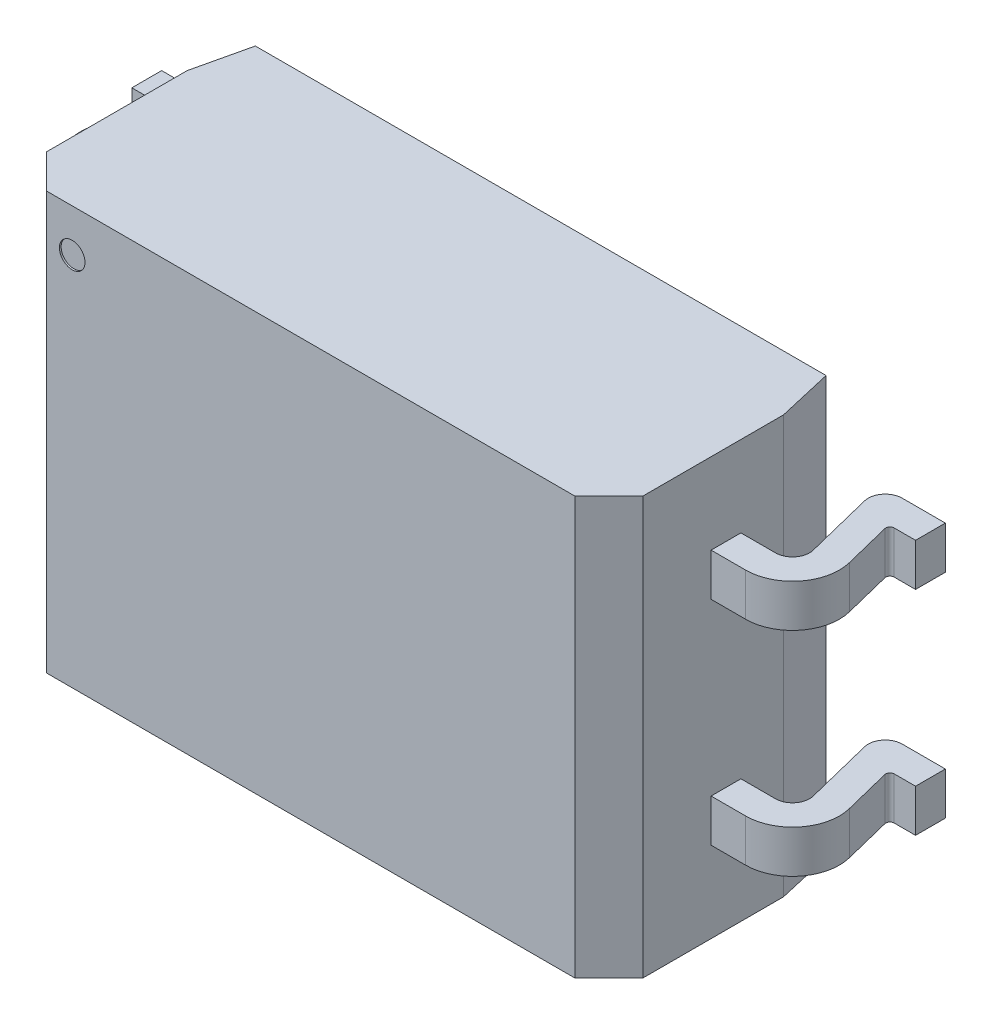
from build123d import *

# Parameters (mm, degrees)
SKETCH_2_W                     = 4.9
SKETCH_2_H                     = 7
EXTRUDE_1_DEPTH                = 2.7
EXTRUDE_2_DEPTH                = 0.25
FILLET_1_R                     = 0.05
CHAMFER_1_SIZE                 = 0.4
PATTERN_LINEAR_2_COUNT         = 2
PATTERN_LINEAR_2_PITCH         = 2.5
FILLET_1_OF_PATTERN_LINEAR_2_R = 0.05
MIRROR_START                   = -1.5
MIRROR_1_DEPTH                 = 0.5
MIRROR_START_2                 = 1
MIRROR_1_2_DEPTH               = 0.5
CHAMFER_2_SIZE                 = 0.4
CHAMFER_3_SIZE                 = 0.15
CHAMFER_3_SIZE2                = 0.649721381
CHAMFER_4_SIZE                 = 0.15
CHAMFER_4_SIZE2                = 0.649721381
SKETCH_7_R                     = 0.15
CUT_EXTRUDE_2_DEPTH            = 0.02
MOVE_BODY_2_ANGLE              = 120


with BuildPart() as part:
    # Эскиз2 → Бобышка-Вытянуть1 (new body)
    with BuildSketch(Plane(origin=(0, 0.15, 0), x_dir=(-1, 0, 0), z_dir=(0, 1, 0))):
        Rectangle(SKETCH_2_W, SKETCH_2_H)
    extrude(amount=EXTRUDE_1_DEPTH)

    # Эскиз4 → Вытянуть-Тонкостенный2 (add, symmetric)
    with BuildSketch(Plane(origin=(1.25, 0, 0), x_dir=(0, 0, -1), z_dir=(1, 0, 0))):
        with BuildLine():
            Line((-3.5, 1.3), (-3.905923723, 1.3))
            ThreePointArc((-3.905923723, 1.3), (-4.063504056, 1.223160215), (-4.1, 1.051684386))
            Line((-4.1, 1.051684386), (-3.9, 0.248315614))
            ThreePointArc((-3.9, 0.248315614), (-3.936495944, 0.076839785), (-4.094076277, 0))
            Line((-4.094076277, 0), (-4.6, 0))
            Line((-4.6, 0), (-4.6, 0.35))
            Line((-4.6, 0.35), (-4.285997426, 0.35))
            Line((-4.285997426, 0.35), (-4.439633485, 0.967132062))
            ThreePointArc((-4.439633485, 0.967132062), (-4.339269639, 1.438690592), (-3.905923723, 1.65))
            Line((-3.905923723, 1.65), (-3.5, 1.65))
            Line((-3.5, 1.65), (-3.5, 1.3))
        make_face()
    extrude_2 = extrude(amount=EXTRUDE_2_DEPTH, both=True)

    # Скругление1
    fillet_1_edges = [part.edges().sort_by_distance(p)[0] for p in [
        (1.25, 0.35, 4.285997426),
    ]]
    fillet(fillet_1_edges, radius=FILLET_1_R)

    # Фаска1
    chamfer_1_edges = [part.edges().sort_by_distance(p)[0] for p in [
        (0, 2.85, 3.5),
    ]]
    chamfer(chamfer_1_edges, length=CHAMFER_1_SIZE)

    # Линейный массив2: Вытянуть-Тонкостенный2 ×2
    with Locations(*[(-i * PATTERN_LINEAR_2_PITCH, 0, 0) for i in range(1, PATTERN_LINEAR_2_COUNT)]):
        add(extrude_2)

    # Скругление1 of Линейный массив2
    fillet_1_of_pattern_linear_2_edges = [part.edges().sort_by_distance(p)[0] for p in [
        (-1.25, 0.35, 4.285997426),
    ]]
    fillet(fillet_1_of_pattern_linear_2_edges, radius=FILLET_1_OF_PATTERN_LINEAR_2_R)

    # Зеркальное отражение1: read off the stored shape, not the designer's step
    # Зеркальное отражение1 outline → Зеркальное отражение1 (add)
    with BuildSketch(Plane.YZ.offset(MIRROR_START)):
        with BuildLine():
            Line((0, -4.6), (0.35, -4.6))
            Line((0.35, -4.6), (0.35, -4.349971142))
            ThreePointArc((0.35, -4.349971142), (0.369209946, -4.310576059), (0.412078903, -4.301452073))
            Line((0.412078903, -4.301452073), (0.967132062, -4.439633485))
            ThreePointArc((0.967132062, -4.439633485), (1.438690592, -4.339269639), (1.65, -3.905923723))
            Line((1.65, -3.905923723), (1.65, -3.5))
            Line((1.65, -3.5), (1.3, -3.5))
            Line((1.3, -3.5), (1.3, -3.905923723))
            ThreePointArc((1.3, -3.905923723), (1.223160215, -4.063504056), (1.051684386, -4.1))
            Line((1.051684386, -4.1), (0.248315614, -3.9))
            ThreePointArc((0.248315614, -3.9), (0.076839785, -3.936495944), (0, -4.094076277))
            Line((0, -4.094076277), (0, -4.6))
        make_face()
    extrude(amount=MIRROR_1_DEPTH)

    # Mirror 1 2 outline → Mirror 1 2 (add)
    with BuildSketch(Plane.YZ.offset(MIRROR_START_2)):
        with BuildLine():
            Line((0, -4.6), (0.35, -4.6))
            Line((0.35, -4.6), (0.35, -4.349971142))
            ThreePointArc((0.35, -4.349971142), (0.369209946, -4.310576059), (0.412078903, -4.301452073))
            Line((0.412078903, -4.301452073), (0.967132062, -4.439633485))
            ThreePointArc((0.967132062, -4.439633485), (1.438690592, -4.339269639), (1.65, -3.905923723))
            Line((1.65, -3.905923723), (1.65, -3.5))
            Line((1.65, -3.5), (1.3, -3.5))
            Line((1.3, -3.5), (1.3, -3.905923723))
            ThreePointArc((1.3, -3.905923723), (1.223160215, -4.063504056), (1.051684386, -4.1))
            Line((1.051684386, -4.1), (0.248315614, -3.9))
            ThreePointArc((0.248315614, -3.9), (0.076839785, -3.936495944), (0, -4.094076277))
            Line((0, -4.094076277), (0, -4.6))
        make_face()
    extrude(amount=MIRROR_1_2_DEPTH)

    # Фаска2
    chamfer_2_edges = [part.edges().sort_by_distance(p)[0] for p in [
        (0, 2.85, -3.5),
    ]]
    chamfer(chamfer_2_edges, length=CHAMFER_2_SIZE)

    # Фаска3
    chamfer_3_edges = [part.edges().sort_by_distance(p)[0] for p in [
        (0, 0.15, -3.5),
    ]]
    chamfer_3_side = [part.faces().sort_by_distance(p)[0] for p in [
        (0, 0.15, 0),
    ]]
    chamfer(chamfer_3_edges, length=CHAMFER_3_SIZE, length2=CHAMFER_3_SIZE2, reference=chamfer_3_side[0])

    # Фаска4
    chamfer_4_edges = [part.edges().sort_by_distance(p)[0] for p in [
        (0, 0.15, 3.5),
    ]]
    chamfer_4_side = [part.faces().sort_by_distance(p)[0] for p in [
        (0, 0.15, 0.075),
    ]]
    chamfer(chamfer_4_edges, length=CHAMFER_4_SIZE, length2=CHAMFER_4_SIZE2, reference=chamfer_4_side[0])

    # Эскиз7 → Вырез-Вытянуть2 (cut)
    with BuildSketch(Plane(origin=(0, 2.85, 0), x_dir=(1, 0, 0), z_dir=(0, 1, 0))):
        with Locations(Location((-1.95, -2.8, 0), (0, 0, 270))):
            Circle(SKETCH_7_R)
    extrude(amount=-CUT_EXTRUDE_2_DEPTH, mode=Mode.SUBTRACT)


with BuildPart() as part_1:
    # Move Body 2: read off the stored shape, not the designer's step
    # Move Body 2: moved
    add(part.part.moved(Location((1.25, 0, -4.425))).rotate(Axis((0, 0, 0), (0.5773502692, -0.5773502692, -0.5773502692)), MOVE_BODY_2_ANGLE))


solid = part_1.part
